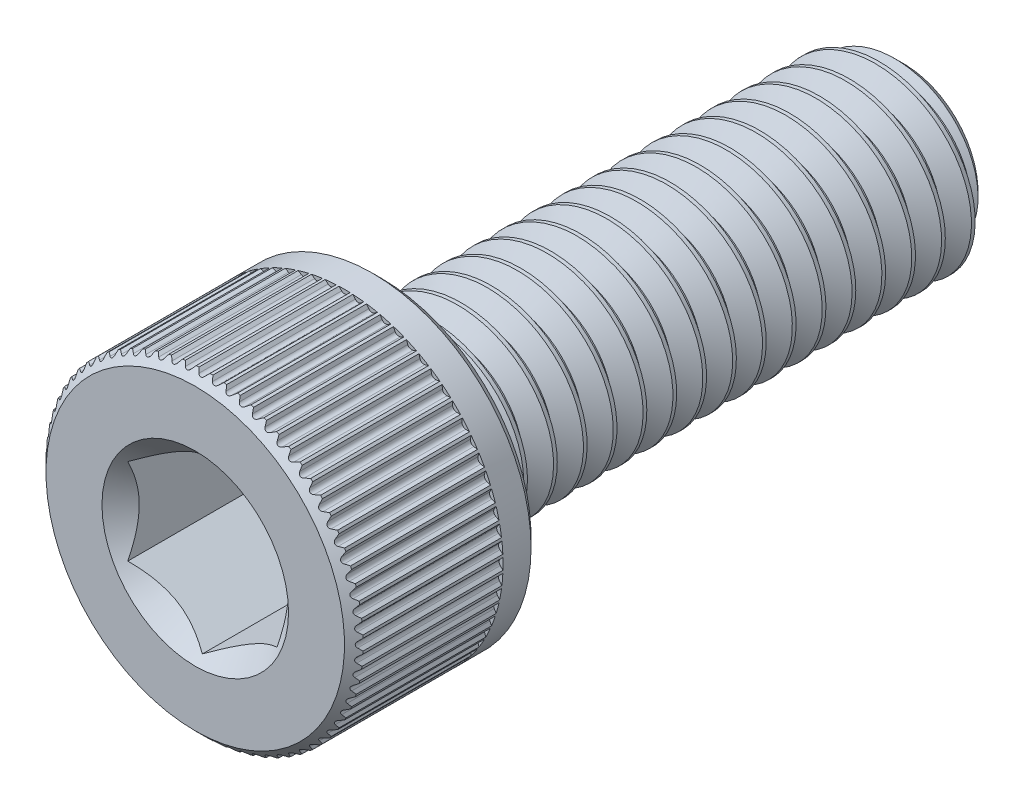
from build123d import *

# Parameters (mm, degrees)
CUT_EXTRUDE1_DEPTH     = 4
SPLIT1_SURFACE_1_BACK  = 23.483
SPLIT1_SURFACE_1_DEPTH = 46.966
SPLIT1_SURFACE_2_BACK  = 23.483
SPLIT1_SURFACE_2_DEPTH = 46.966
CUT_SWEEP1_PITCH       = 0.8
CUT_EXTRUDE3_DEPTH     = 4
CIRPATTERN1_COUNT      = 72


with BuildPart() as part:
    # Sketch2 → Revolve1 (revolve)
    with BuildSketch(Plane(origin=(0, 0, 0), x_dir=(0, 0, -1), z_dir=(1, 0, 0))):
        with BuildLine():
            Line((-9.5, 0), (-9.5, 4))
            Line((-9.5, 4), (-9.25, 4.25))
            Line((-9.25, 4.25), (-4.75, 4.25))
            Line((-4.75, 4.25), (-4.5, 4))
            Line((-4.5, 4), (-4.5, 2.75))
            ThreePointArc((-4.5, 2.75), (-4.426776695, 2.573223305), (-4.25, 2.5))
            Line((-4.25, 2.5), (8.980384758, 2.5))
            Line((8.980384758, 2.5), (9.5, 1.980384758))
            Line((9.5, 1.980384758), (9.5, 0))
            Line((9.5, 0), (-9.5, 0))
        make_face()
    revolve(axis=Axis((0, 0, -9.5), (0, 0, 1)))

    # Sketch3 → Cut-Extrude1 (cut)
    with BuildSketch(Plane.XY.offset(9.5)):
        Polygon((2, -1.154700538), (2, 1.154700538), (0, 2.309401077), (-2, 1.154700538), (-2, -1.154700538), (0, -2.309401077), align=None)
    extrude(amount=-CUT_EXTRUDE1_DEPTH, mode=Mode.SUBTRACT)

    # Cut-Extrude2 cone 1 section (through the dimple's axis) → Cut-Extrude2 (revolve, cut)
    with BuildSketch(Plane(origin=(0, 0, 9.5), x_dir=(0, -1, 0), z_dir=(1, 0, 0))):
        Polygon((0, 0), (2.5, 0), (0, 2.5), align=None)
    revolve(axis=Axis((0, 0, 9.5), (0, 0, -1)), mode=Mode.SUBTRACT)


with BuildPart() as body_2:
    # Split1: the piece behind the surface
    add(part.part)
    # Split1 surface: a surface, the sketch's curves swept straight by 46.966 mm
    with BuildLine(Plane(origin=(0, 0, 0), x_dir=(0, 0, -1), z_dir=(1, 0, 0)).offset(-SPLIT1_SURFACE_1_BACK), mode=Mode.PRIVATE) as split1_surface_1_path:
        Line((-4.25, -4.25), (-4.25, 4.25))
    split1_surface_1 = Shell.extrude(split1_surface_1_path.wire(), (1 * SPLIT1_SURFACE_1_DEPTH, 0 * SPLIT1_SURFACE_1_DEPTH, 0 * SPLIT1_SURFACE_1_DEPTH))
    split(bisect_by=split1_surface_1, keep=Keep.BOTTOM)

    # Cut-Sweep1: the profile of Sketch7 screwed along a right-hand helix of 18.5 turns, 8 arcs to a turn; built about Z, then put on its axis
    cut_sweep1_z = Axis((0, 0, 0), (0, 0, 1))
    cut_sweep1_corners = [(2.54330127, 0, 0.025), (2.54330127, 0, -0.725), (1.980384758, 0, -0.4), (1.980384758, 0, -0.3)]
    with BuildLine(mode=Mode.PRIVATE) as cut_sweep1_profile:
        Line(cut_sweep1_corners[0], cut_sweep1_corners[1])
        Line(cut_sweep1_corners[1], cut_sweep1_corners[2])
        Line(cut_sweep1_corners[2], cut_sweep1_corners[3])
        Line(cut_sweep1_corners[3], cut_sweep1_corners[0])
    cut_sweep1_cap = Face(cut_sweep1_profile.wire())
    cut_sweep1_turn_angles = [0, 22.5, 45, 67.5, 90, 112.5, 135, 157.5, 180, 202.5, 225, 247.5, 270, 292.5, 315, 337.5, 360]
    cut_sweep1_turn_weights = [1, 0.9238795325112867, 1, 0.9238795325112867, 1, 0.9238795325112867, 1, 0.9238795325112867, 1, 0.9238795325112867, 1, 0.9238795325112867, 1, 0.9238795325112867, 1, 0.9238795325112867, 1]
    cut_sweep1_turn_rails = [Edge.make_bspline([Vector(p[0], p[1], 0).rotate(cut_sweep1_z, cut_sweep1_turn_angles[k]) / cut_sweep1_turn_weights[k] + Vector(0, 0, p[2] + CUT_SWEEP1_PITCH * cut_sweep1_turn_angles[k] / 360) for k in range(17)], [0, 0, 0, 1, 1, 2, 2, 3, 3, 4, 4, 5, 5, 6, 6, 7, 7, 8, 8, 8], 2, cut_sweep1_turn_weights) for p in cut_sweep1_corners]
    cut_sweep1_turn_sides = [Face.make_surface_from_curves(cut_sweep1_turn_rails[p[0]], cut_sweep1_turn_rails[p[1]]) for p in [(0, 1), (1, 2), (2, 3), (3, 0)]]
    cut_sweep1_last_angles = [6480, 6502.5, 6525, 6547.5, 6570, 6592.5, 6615, 6637.5, 6660]
    cut_sweep1_last_weights = [1, 0.9238795325112867, 1, 0.9238795325112867, 1, 0.9238795325112867, 1, 0.9238795325112442, 1]
    cut_sweep1_last_rails = [Edge.make_bspline([Vector(p[0], p[1], 0).rotate(cut_sweep1_z, cut_sweep1_last_angles[k]) / cut_sweep1_last_weights[k] + Vector(0, 0, p[2] + CUT_SWEEP1_PITCH * cut_sweep1_last_angles[k] / 360) for k in range(9)], [0, 0, 0, 1, 1, 2, 2, 3, 3, 4, 4, 4], 2, cut_sweep1_last_weights) for p in cut_sweep1_corners]
    cut_sweep1_last_sides = [Face.make_surface_from_curves(cut_sweep1_last_rails[p[0]], cut_sweep1_last_rails[p[1]]) for p in [(0, 1), (1, 2), (2, 3), (3, 0)]]
    cut_sweep1 = Plane(origin=(0, 0, -9.5), x_dir=(0, 1, 0), z_dir=(0, 0, 1)) * Solid(Shell([*[p.moved(Location((0, 0, CUT_SWEEP1_PITCH * i))) for i in range(18) for p in cut_sweep1_turn_sides], *cut_sweep1_last_sides, cut_sweep1_cap, cut_sweep1_cap.rotate(cut_sweep1_z, 6660).moved(Location((0, 0, CUT_SWEEP1_PITCH * 6660 / 360)))]))
    add(cut_sweep1, mode=Mode.SUBTRACT)


with BuildPart() as part_1:
    add(part.part)

    # Split1: split by a surface, the side it looks to stays
    # Split1 surface: a surface, the sketch's curves swept straight by 46.966 mm
    with BuildLine(Plane(origin=(0, 0, 0), x_dir=(0, 0, -1), z_dir=(1, 0, 0)).offset(-SPLIT1_SURFACE_2_BACK), mode=Mode.PRIVATE) as split1_surface_2_path:
        Line((-4.25, -4.25), (-4.25, 4.25))
    split1_surface_2 = Shell.extrude(split1_surface_2_path.wire(), (1 * SPLIT1_SURFACE_2_DEPTH, 0 * SPLIT1_SURFACE_2_DEPTH, 0 * SPLIT1_SURFACE_2_DEPTH))
    split(bisect_by=split1_surface_2, keep=Keep.TOP)

    add(body_2.part)  # Revolve2 merges body 2
    # Sketch8 → Revolve2 (revolve)
    with BuildSketch(Plane(origin=(0, 0, 0), x_dir=(0, 0, -1), z_dir=(1, 0, 0)), mode=Mode.PRIVATE) as revolve2_sk:
        Polygon((-4.5, 0), (-4.5, 2.5), (-4.25, 2.5), (-2.806624327, 0), align=None)
    revolve(revolve2_sk.sketch.rotate(Axis((0, 0, 2.806624327), (0, 0, 1)), 270), axis=Axis((0, 0, 2.806624327), (0, 0, 1)))

    # Sketch12 → Cut-Extrude3 (cut)
    with BuildSketch(Plane.XY.offset(9.5)):
        with BuildLine():
            Line((-0.257161846, 4.35625), (0.257161846, 4.35625))
            Line((0.257161846, 4.35625), (0.07624254, 4.175330694))
            ThreePointArc((0.07624254, 4.175330694), (0, 4.14375), (-0.07624254, 4.175330694))
            Line((-0.07624254, 4.175330694), (-0.257161846, 4.35625))
        make_face()
    cut_extrude3 = extrude(amount=-CUT_EXTRUDE3_DEPTH, mode=Mode.SUBTRACT)

    # CirPattern1: Cut-Extrude3 ×72 about axis
    cirpattern1_axis = Axis((0, 0, 0), (0, 0, 1))
    for i in range(1, CIRPATTERN1_COUNT):
        add(cut_extrude3.rotate(cirpattern1_axis, i * 360 / CIRPATTERN1_COUNT), mode=Mode.SUBTRACT)


solid = part_1.part
